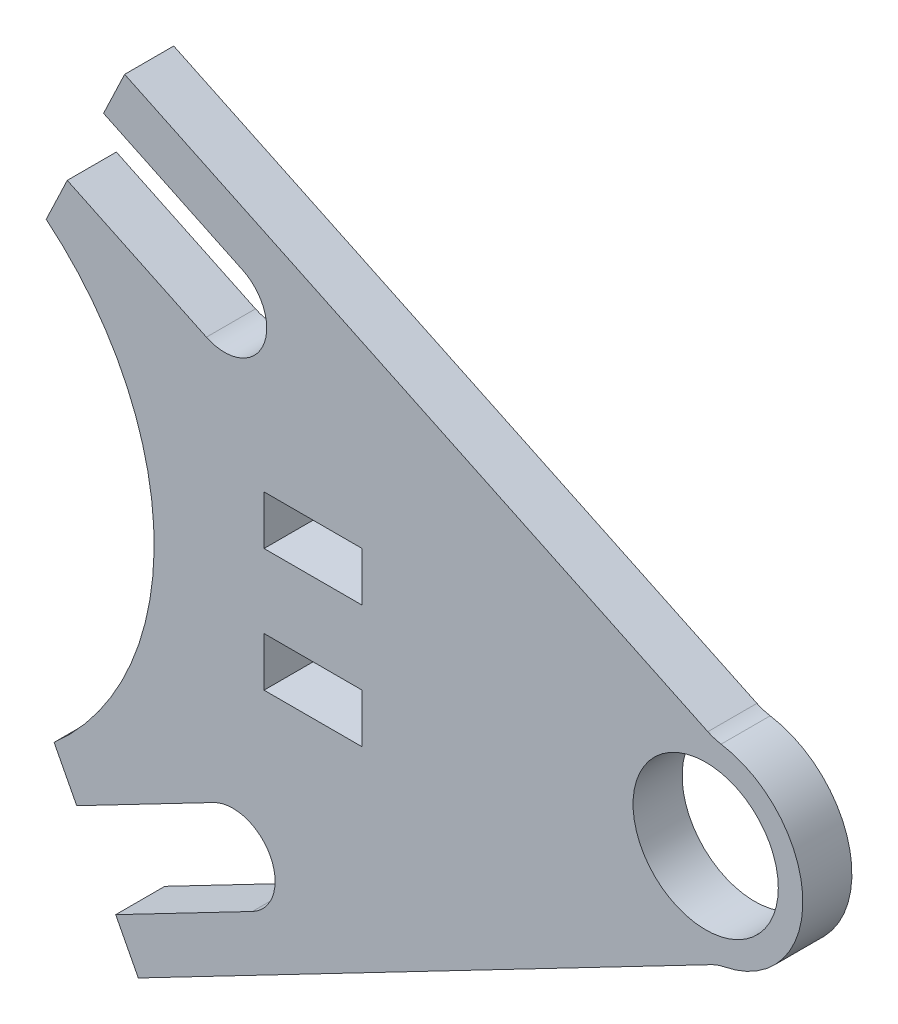
from build123d import *

# Parameters (mm, degrees)
SKETCH1_R           = 12.573
SKETCH1_R_2         = 9.398
BOSS_EXTRUDE1_DEPTH = 3.175
FILLET1_R           = 38.1
FILLET2_R           = 6.35
SKETCH2_W           = 12.7
SKETCH2_H           = 6.35
CUT_EXTRUDE1_DEPTH  = 3.175


with BuildPart() as part:
    # Sketch1 → Boss-Extrude1 (new, symmetric)
    # profile 1 of 4: a face of its own
    with BuildSketch(Plane.XY):
        with BuildLine():
            Line((503.446781124, -1524.922120572), (521.448925186, -1533.494549061))
            ThreePointArc((521.448925186, -1533.494549061), (524.031586139, -1540.772935173), (516.753200026, -1543.355596126))
            Line((516.753200026, -1543.355596126), (498.751055965, -1534.783167637))
            Line((498.751055965, -1534.783167637), (496.020983198, -1540.516334536))
            Line((496.020983198, -1540.516334536), (554.871597872, -1568.540367902))
            Line((554.871597872, -1568.540367902), (572.088750719, -1559.584617136))
            ThreePointArc((572.088750719, -1559.584617136), (576.84535815, -1556.340422204), (582.549387726, -1555.556737566))
            Line((582.549387726, -1555.556737566), (506.176853892, -1519.188953673))
            Line((506.176853892, -1519.188953673), (503.446781124, -1524.922120572))
        make_face()
    # profile 2 of 4: a face of its own
    with BuildSketch(Plane.XY):
        with BuildLine():
            ThreePointArc((572.393517032, -1576.884118428), (568.792205752, -1568.295127748), (572.088750719, -1559.584617136))
            Line((572.088750719, -1559.584617136), (554.871597872, -1568.540367902))
            Line((554.871597872, -1568.540367902), (572.393517032, -1576.884118428))
        make_face()
    # profile 3 of 4: a face of its own
    with BuildSketch(Plane.XY):
        with BuildLine():
            Line((572.393517032, -1576.884118428), (554.871597872, -1568.540367902))
            Line((554.871597872, -1568.540367902), (497.044597377, -1598.619917556))
            Line((497.044597377, -1598.619917556), (499.974916446, -1604.253365004))
            Line((499.974916446, -1604.253365004), (517.663941434, -1595.052163128))
            ThreePointArc((517.663941434, -1595.052163128), (525.028780639, -1597.376853534), (522.704090232, -1604.741692739))
            Line((522.704090232, -1604.741692739), (505.015065244, -1613.942894615))
            Line((505.015065244, -1613.942894615), (507.945384313, -1619.576342064))
            Line((507.945384313, -1619.576342064), (582.989537655, -1580.541041645))
            ThreePointArc((582.989537655, -1580.541041645), (577.261443726, -1579.958757387), (572.393517032, -1576.884118428))
        make_face()
    # profile 4 of 4: a face of its own
    with BuildSketch(Plane.XY):
        with Locations((581.363255123, -1568.073662845)):
            Circle(SKETCH1_R)
        with Locations((581.363255123, -1568.073662845)):
            Circle(SKETCH1_R_2, mode=Mode.SUBTRACT)
    extrude(amount=BOSS_EXTRUDE1_DEPTH, both=True)

    # Fillet1
    # the kernel refuses this fillet: 38.1 mm, written as the material it adds along each edge
    with BuildSketch(Plane(origin=(554.871597872, -1568.540367902, -3.175), x_dir=(-0.9028609288940066, 0.4299327192441295, 0), z_dir=(0, 0, 1))) as fillet1_piece_1:
        with BuildLine():
            CenterArc((74.290255, 36.995356759), FILLET1_R, 156.775740193, 99.393657747)
            Line((39.277556806, 52.01936971), (0, 0))
            Line((0, 0), (65.1823695, 0))
        make_face()
    extrude(amount=6.35)

    # Fillet2
    fillet2_edges = [part.edges().sort_by_distance(p)[0] for p in [
        (582.549387726, -1555.556737566, 0),
        (582.989537655, -1580.541041645, 0),
    ]]
    fillet(fillet2_edges, radius=FILLET2_R)

    # Sketch2 → Cut-Extrude1 (cut, symmetric)
    with BuildSketch(Plane.XY):
        with Locations((530.563255123, -1560.136162845)):
            Rectangle(SKETCH2_W, SKETCH2_H)
        with Locations((530.563255123, -1576.011162845)):
            Rectangle(SKETCH2_W, SKETCH2_H)
    extrude(amount=CUT_EXTRUDE1_DEPTH, both=True, mode=Mode.SUBTRACT)


solid = part.part
